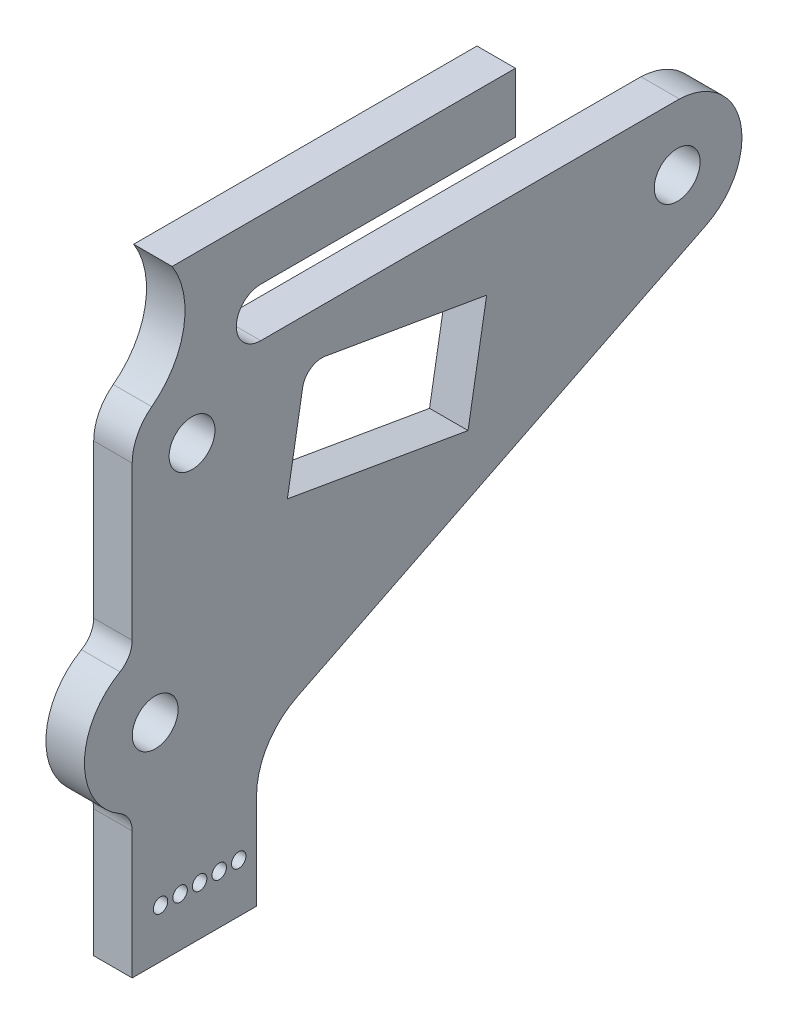
from build123d import *

# Parameters (mm, degrees)
SKETCH1_R           = 2.38125
SKETCH1_R_2         = 0.75
BOSS_EXTRUDE1_DEPTH = 2


with BuildPart() as part:
    # Sketch1 → Boss-Extrude1 (new, symmetric)
    with BuildSketch(Plane(origin=(0, 0, 0), x_dir=(0, 0, -1), z_dir=(1, 0, 0))):
        with BuildLine():
            Line((-56.625400227, 2.386991318), (-56.625400227, -13.559221537))
            ThreePointArc((-56.625400227, -13.559221537), (-56.966991368, -14.831463057), (-57.899887224, -15.761510537))
            ThreePointArc((-57.899887224, -15.761510537), (-61.589569936, -22.137211246), (-57.899887224, -28.512911956))
            ThreePointArc((-57.899887224, -28.512911956), (-56.966991368, -29.442959435), (-56.625400227, -30.715200956))
            Line((-56.625400227, -30.715200956), (-56.625400227, -43.943749635))
            Line((-56.625400227, -43.943749635), (-43.707520647, -43.943749635))
            Line((-43.707520647, -43.943749635), (-43.707520647, -34.030414011))
            ThreePointArc((-43.707520647, -34.030414011), (-42.567322793, -30.020854914), (-39.487950002, -27.21121463))
            Line((-39.487950002, -27.21121463), (-25.808814493, -20.390042329))
            Line((-25.808814493, -20.390042329), (3.003273, -6.022744555))
            ThreePointArc((3.003273, -6.022744555), (6.576528363, 1.429116992), (0.23290188, 6.72598375))
            Line((0.23290188, 6.72598375), (-43.266362514, 6.72598375))
            ThreePointArc((-43.266362514, 6.72598375), (-45.806362514, 9.26598375), (-43.266362514, 11.80598375))
            Line((-43.266362514, 11.80598375), (-16.803992093, 11.80598375))
            Line((-16.803992093, 11.80598375), (-16.803992093, 18.009025029))
            Line((-16.803992093, 18.009025029), (-52.475776529, 18.009025029))
            ThreePointArc((-52.475776529, 18.009025029), (-51.277962728, 11.814262359), (-54.597011148, 6.44828062))
            ThreePointArc((-54.597011148, 6.44828062), (-56.090099528, 4.65681692), (-56.625400227, 2.386991318))
        make_face()
        Circle(SKETCH1_R, mode=Mode.SUBTRACT)
        with Locations((-45.553086475, -38.863749635)):
            Circle(SKETCH1_R_2, mode=Mode.SUBTRACT)
        with Locations((-47.585086475, -38.863749635)):
            Circle(SKETCH1_R_2, mode=Mode.SUBTRACT)
        with Locations((-49.617086475, -38.863749635)):
            Circle(SKETCH1_R_2, mode=Mode.SUBTRACT)
        with Locations((-51.649086475, -38.863749635)):
            Circle(SKETCH1_R_2, mode=Mode.SUBTRACT)
        with Locations((-54.236184525, -22.137211246)):
            Circle(SKETCH1_R, mode=Mode.SUBTRACT)
        with Locations((-50.410128911, 1.079375692)):
            Circle(SKETCH1_R, mode=Mode.SUBTRACT)
        with Locations((-53.681086475, -38.863749635)):
            Circle(SKETCH1_R_2, mode=Mode.SUBTRACT)
        with BuildLine():
            Line((-36.568397511, 1.976008906), (-19.797694446, -0.914638547))
            Line((-19.797694446, -0.914638547), (-21.730897843, -12.13052726))
            Line((-21.730897843, -12.13052726), (-40.504072916, -8.894727872))
            Line((-40.504072916, -8.894727872), (-38.916021454, 0.318688833))
            ThreePointArc((-38.916021454, 0.318688833), (-38.085451708, 1.633557707), (-36.568397511, 1.976008906))
        make_face(mode=Mode.SUBTRACT)
    extrude(amount=BOSS_EXTRUDE1_DEPTH, both=True)


solid = part.part
